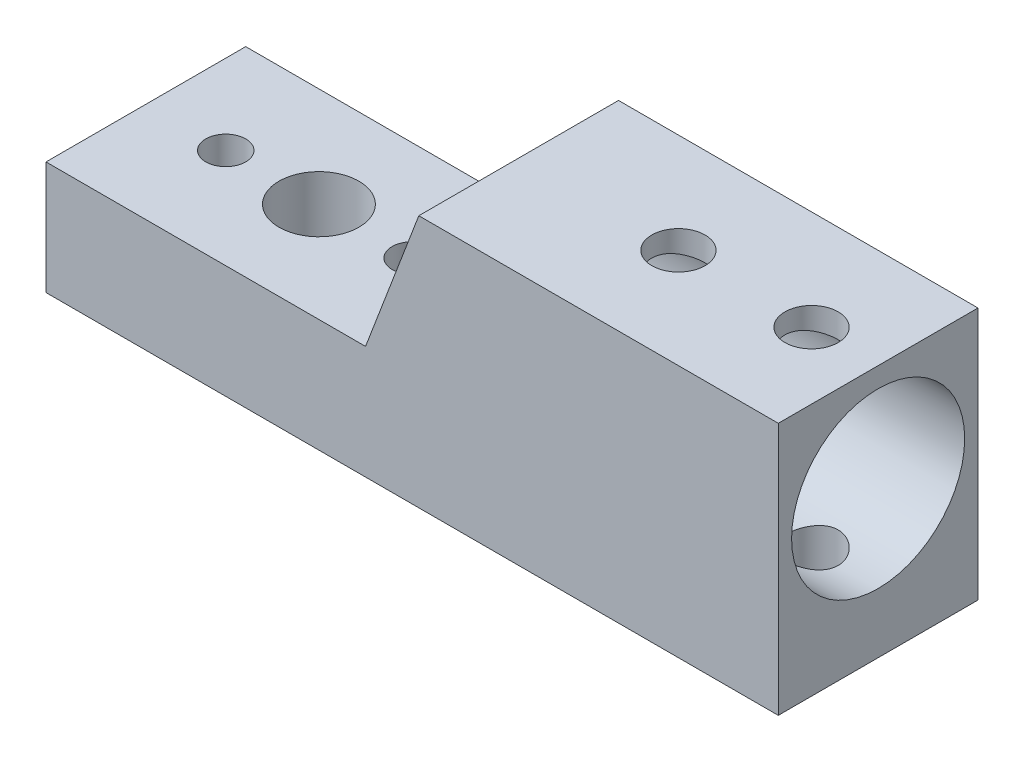
from build123d import *

# Parameters (mm, degrees)
SKETCH1_W               = 15
SKETCH1_H               = 19
SKETCH1_R               = 6.5
BOSS_EXTRUDE1_DEPTH     = 25
SKETCH2_W               = 15
SKETCH2_H               = 19
BOSS_EXTRUDE2_DEPTH     = 2
CUT_EXTRUDE1_DEPTH      = 29.324018077
CUT_EXTRUDE1_DEPTH_BACK = 29.324018077
SKETCH4_R               = 2
SKETCH3_W               = 28
SKETCH3_H               = 15
SKETCH3_R               = 3
BOSS_EXTRUDE3_DEPTH     = 8.5
CHAMFER1_SIZE2          = 10.5
CHAMFER1_SIZE           = 4
SKETCH6_R               = 1.5
CUT_EXTRUDE3_DEPTH      = 33.657311618
SKETCH7_R               = 3
CUT_EXTRUDE4_DEPTH      = 3


with BuildPart() as part:
    # Sketch1 → Boss-Extrude1 (new body)
    with BuildSketch(Plane(origin=(0, 0, 0), x_dir=(0, 0, -1), z_dir=(1, 0, 0))):
        with Locations((0, -1.5)):
            Rectangle(SKETCH1_W, SKETCH1_H)
        Circle(SKETCH1_R, mode=Mode.SUBTRACT)
    extrude(amount=BOSS_EXTRUDE1_DEPTH)

    # Sketch2 → Boss-Extrude2 (add)
    with BuildSketch(Plane(origin=(0, 0, 0), x_dir=(0, 0, -1), z_dir=(1, 0, 0))):
        with Locations((0, -1.5)):
            Rectangle(SKETCH2_W, SKETCH2_H)
    extrude(amount=-BOSS_EXTRUDE2_DEPTH)

    # Sketch4 → Cut-Extrude1 (cut, two sides: drawn at the far end of the back side and taken through both)
    with BuildSketch(Plane(origin=(0, 0, 0), x_dir=(1, 0, 0), z_dir=(0, 1, 0)).offset(-CUT_EXTRUDE1_DEPTH_BACK)):
        with Locations(Location((10, 0, 0), (0, 0, 270))):
            Circle(SKETCH4_R)
        with Locations(Location((20, 0, 0), (0, 0, 270))):
            Circle(SKETCH4_R)
    extrude(amount=CUT_EXTRUDE1_DEPTH + CUT_EXTRUDE1_DEPTH_BACK, mode=Mode.SUBTRACT)

    # Sketch3 → Boss-Extrude3 (add)
    with BuildSketch(Plane(origin=(0, -2.5, 0), x_dir=(1, 0, 0), z_dir=(0, 1, 0))):
        with Locations((-16, 0)):
            Rectangle(SKETCH3_W, SKETCH3_H)
        with Locations(Location((-17, 0, 0), (0, 0, 270))):
            Circle(SKETCH3_R, mode=Mode.SUBTRACT)
    extrude(amount=-BOSS_EXTRUDE3_DEPTH)

    # Chamfer1
    chamfer1_edges = [part.edges().sort_by_distance(p)[0] for p in [
        (-2, -2.5, 0),
    ]]
    chamfer1_side = [part.faces().sort_by_distance(p)[0] for p in [
        (-2.08, -2.5, 0),
    ]]
    chamfer(chamfer1_edges, length=CHAMFER1_SIZE - 0.0001, length2=CHAMFER1_SIZE2 - 0.0001, reference=chamfer1_side[0])  # a hair under: the kernel refuses the full size

    # Sketch6 → Cut-Extrude3 (cut, through all)
    with BuildSketch(Plane(origin=(0, -2.5, 0), x_dir=(1, 0, 0), z_dir=(0, 1, 0))):
        with Locations(Location((-24, 0, 0), (0, 0, 270))):
            Circle(SKETCH6_R)
        with Locations(Location((-10, 0, 0), (0, 0, 270))):
            Circle(SKETCH6_R)
    extrude(amount=-CUT_EXTRUDE3_DEPTH, mode=Mode.SUBTRACT)

    # Sketch7 → Cut-Extrude4 (cut)
    with BuildSketch(Plane.XZ.offset(11)):
        with Locations(Location((-10, 0, 0), (0, 0, 270))):
            Circle(SKETCH7_R)
        with Locations(Location((-24, 0, 0), (0, 0, 90))):
            Circle(SKETCH7_R)
    extrude(amount=-CUT_EXTRUDE4_DEPTH, mode=Mode.SUBTRACT)


solid = part.part
